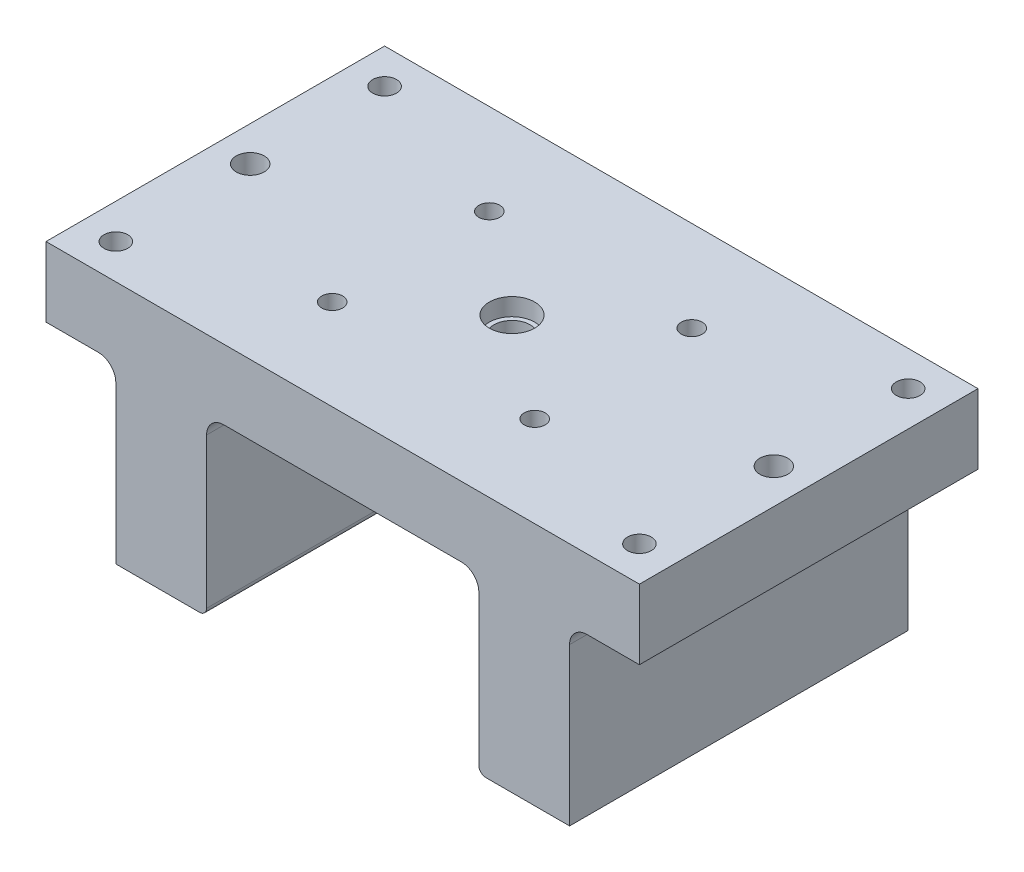
from build123d import *

# Parameters (mm, degrees)
SKETCH1_W                = 130
SKETCH1_H                = 97
BOSS_EXTRUDE1_DEPTH      = 70
SKETCH2_W                = 78
SKETCH2_H                = 50
CUT_EXTRUDE1_DEPTH       = 137.1396342
FILLET3_R                = 5
SKETCH3_R                = 5.2
CUT_EXTRUDE2_DEPTH       = 108.131928014
SKETCH4_R                = 6.5
CUT_EXTRUDE3_DEPTH       = 5
FILLET4_R                = 2
F_5_0_5_DIAMETER_HOLE1_D = 6
SKETCH8_W                = 20
SKETCH8_H                = 97
BOSS_EXTRUDE2_DEPTH      = 20
FILLET5_R                = 5
M8_TAPPED_HOLE1_D        = 6.8
F_8_0MM_DOWEL_HOLE1_D    = 8


with BuildPart() as part:
    # Sketch1 → Boss-Extrude1 (new body)
    with BuildSketch(Plane(origin=(0, 0, 0), x_dir=(1, 0, 0), z_dir=(0, 1, 0))):
        Rectangle(SKETCH1_W, SKETCH1_H)
    extrude(amount=BOSS_EXTRUDE1_DEPTH)

    # Sketch2 → Cut-Extrude1 (cut, through all)
    with BuildSketch(Plane.XY.offset(48.5)):
        with Locations((0, 25)):
            Rectangle(SKETCH2_W, SKETCH2_H)
    extrude(amount=-CUT_EXTRUDE1_DEPTH, mode=Mode.SUBTRACT)

    # Fillet3
    fillet3_edges = [part.edges().sort_by_distance(p)[0] for p in [
        (39, 50, 0),
        (-39, 50, 0),
    ]]
    fillet(fillet3_edges, radius=FILLET3_R)

    # Sketch3 → Cut-Extrude2 (cut, through all)
    with BuildSketch(Plane(origin=(0, 70, 0), x_dir=(1, 0, 0), z_dir=(0, 1, 0))):
        Circle(SKETCH3_R)
    extrude(amount=-CUT_EXTRUDE2_DEPTH, mode=Mode.SUBTRACT)

    # Sketch4 → Cut-Extrude3 (cut)
    with BuildSketch(Plane(origin=(0, 70, 0), x_dir=(1, 0, 0), z_dir=(0, 1, 0))):
        Circle(SKETCH4_R)
    extrude(amount=-CUT_EXTRUDE3_DEPTH, mode=Mode.SUBTRACT)

    # Fillet4
    fillet4_edges = [part.edges().sort_by_distance(p)[0] for p in [
        (39, 0, 0),
        (-39, 0, 0),
    ]]
    fillet(fillet4_edges, radius=FILLET4_R)

    # Ø5.0 (5) Diameter Hole1 (through all)
    with Locations(Plane(origin=(0, 70, 0), x_dir=(1, 0, 0), z_dir=(0, 1, 0))):
        with Locations((-29, 22.5), (29, 22.5), (29, -22.5), (-29, -22.5)):
            Hole(F_5_0_5_DIAMETER_HOLE1_D / 2)

    # Sketch8 → Boss-Extrude2 (add)
    with BuildSketch(Plane(origin=(0, 70, 0), x_dir=(1, 0, 0), z_dir=(0, 1, 0))):
        with Locations((-75, 0)):
            Rectangle(SKETCH8_W, SKETCH8_H)
    boss_extrude2 = extrude(amount=-BOSS_EXTRUDE2_DEPTH)

    # Mirror1: Boss-Extrude2 across plane
    add(boss_extrude2.mirror(Plane(origin=(0, 0, 0), x_dir=(0, 0, 1), z_dir=(1, 0, 0))))

    # Fillet5
    fillet5_edges = [part.edges().sort_by_distance(p)[0] for p in [
        (65, 50, 0),
        (-65, 50, 0),
    ]]
    fillet(fillet5_edges, radius=FILLET5_R)

    # M8 Tapped Hole1 (through all)
    with Locations(Plane(origin=(0, 70, 0), x_dir=(1, 0, 0), z_dir=(0, 1, 0))):
        with Locations((-75, 38.5), (-75, -38.5), (75, -38.5), (75, 38.5)):
            Hole(M8_TAPPED_HOLE1_D / 2)

    # Ø8.0mm Dowel Hole1 (through all)
    with Locations(Plane(origin=(0, 70, 0), x_dir=(1, 0, 0), z_dir=(0, 1, 0))):
        with Locations((-75, 0), (75, 0)):
            Hole(F_8_0MM_DOWEL_HOLE1_D / 2)


solid = part.part
